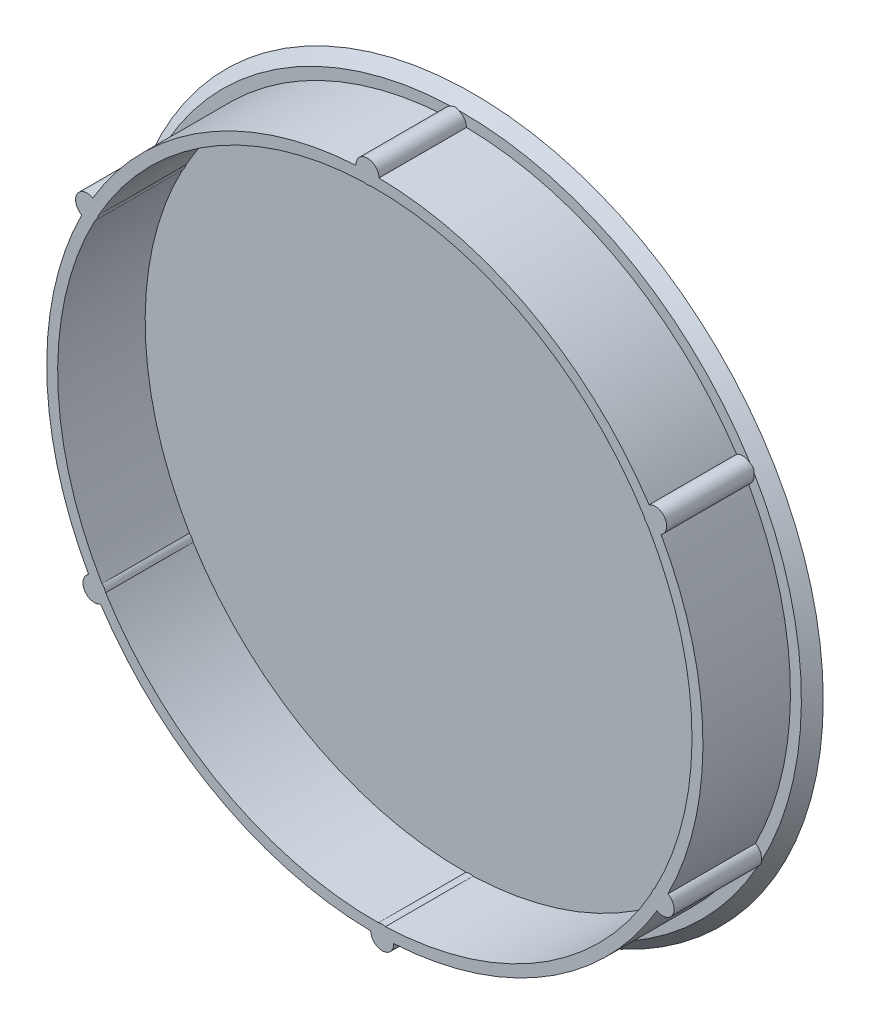
from build123d import *

# Parameters (mm, degrees)
SKETCH_2_R               = 1.051872146
EXTRUDE_1_DEPTH          = 8
PATTERN_CIRCULAR_1_COUNT = 6
CHAMFER_1_SIZE           = 2


with BuildPart() as part:
    # Эскиз1 → Повернуть1 (revolve)
    with BuildSketch(Plane(origin=(0, 0, 0), x_dir=(1, 0, 0), z_dir=(0, 1, 0))):
        Polygon((-39.012426389, 8.189631494), (-39.012426389, 9.189631494), (-6.012426389, 9.189631494), (-6.012426389, 8.189631494), (-35.012426389, 8.189631494), (-35.012426389, 0.189631494), (-36.012426389, 0.189631494), (-36.012426389, 8.189631494), align=None)
    revolve(axis=Axis((-6.012426389, 0, -9.189631494), (0, 0, 1)))

    # Эскиз2 → Бобышка-Вытянуть1 (add)
    with BuildSketch(Plane.XY.offset(-0.189631494)):
        with Locations((-6.68742643, 29.992405288)):
            Circle(SKETCH_2_R)
    extrude_1 = extrude(amount=-EXTRUDE_1_DEPTH)

    # Круговой массив1: Бобышка-Вытянуть1 ×6 about axis
    pattern_circular_1_axis = Axis((-6.012426389, 0, 0), (0, 0, 1))
    for i in range(1, PATTERN_CIRCULAR_1_COUNT):
        add(extrude_1.rotate(pattern_circular_1_axis, i * 360 / PATTERN_CIRCULAR_1_COUNT))

    # Фаска1
    # the kernel refuses this chamfer: 2 mm, written as the material it takes off along each edge
    with BuildSketch(Plane(origin=(-6.012426389, 0, -8.189631494), x_dir=(-1, 0, 0), z_dir=(0, 1, 0))) as chamfer_1_piece_1_section:
        Polygon((33, -CHAMFER_1_SIZE), (33 - CHAMFER_1_SIZE, 0), (33, 0), align=None)
    chamfer_1_piece_1 = revolve(axis=Axis((-6.012426389, 0, -8.189631494), (0, 0, 1)), mode=Mode.PRIVATE)
    chamfer_1_piece_1 = chamfer_1_piece_1 - Plane(origin=(19.62425849, 15.580769827, -9.135558261), x_dir=(0.5000000000000001, -0.8660254037844386, 0), z_dir=(0, 0, 1)) * Cylinder(1.051872146, 132, mode=Mode.PRIVATE)
    chamfer_1_piece_1 = chamfer_1_piece_1 - Plane(origin=(20.299258531, -14.411635461, -9.135558261), x_dir=(-0.5000000000000004, -0.8660254037844384, 0), z_dir=(0, 0, 1)) * Cylinder(1.051872146, 132, mode=Mode.PRIVATE)
    chamfer_1_piece_1 = chamfer_1_piece_1 - Plane(origin=(-5.337426348, -29.992405288, -9.135558261), x_dir=(-1, 0, 0), z_dir=(0, 0, 1)) * Cylinder(1.051872146, 132, mode=Mode.PRIVATE)
    chamfer_1_piece_1 = chamfer_1_piece_1 - Plane(origin=(-31.649111268, -15.580769827, -9.135558261), x_dir=(-0.49999999999999983, 0.8660254037844388, 0), z_dir=(0, 0, 1)) * Cylinder(1.051872146, 132, mode=Mode.PRIVATE)
    chamfer_1_piece_1 = chamfer_1_piece_1 - Plane(origin=(-32.324111309, 14.411635461, -9.135558261), x_dir=(0.5000000000000001, 0.8660254037844386, 0), z_dir=(0, 0, 1)) * Cylinder(1.051872146, 132, mode=Mode.PRIVATE)
    chamfer_1_piece_1 = chamfer_1_piece_1 - Plane(origin=(-6.68742643, 29.992405288, -9.135558261), x_dir=(1, 0, 0), z_dir=(0, 0, 1)) * Cylinder(1.051872146, 132, mode=Mode.PRIVATE)
    add(chamfer_1_piece_1, mode=Mode.SUBTRACT)


solid = part.part
